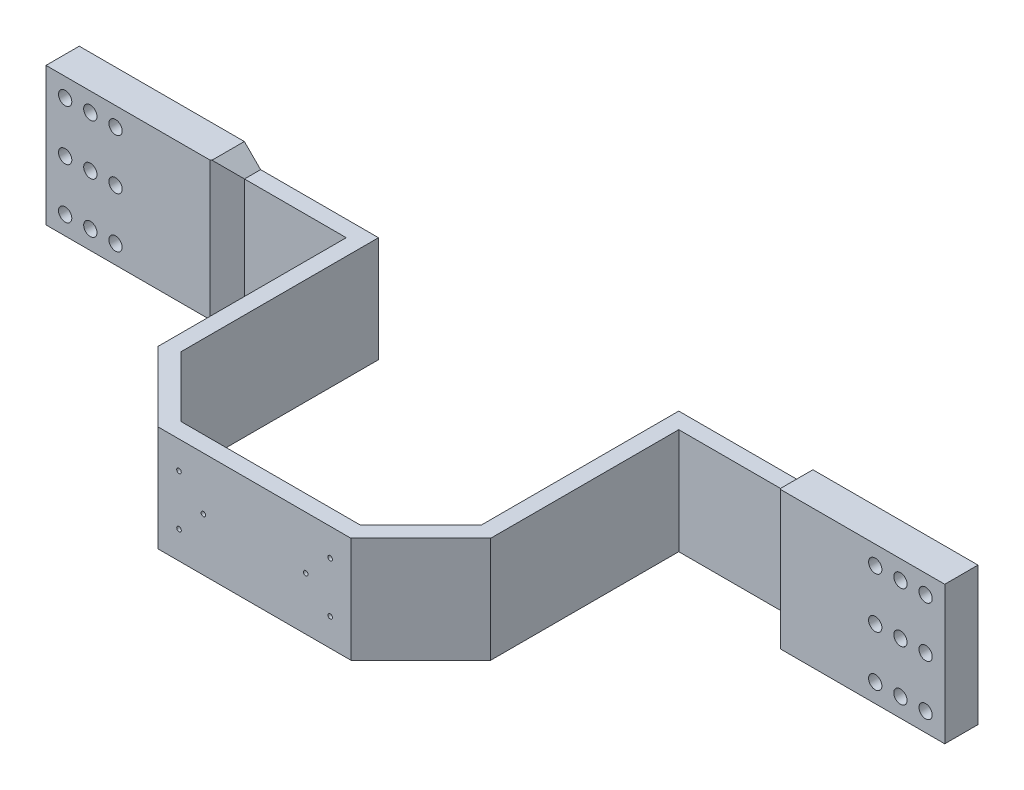
from build123d import *

# Parameters (mm, degrees)
BOSS_EXTRUDE1_DEPTH            = 52.45
F_4_40_TAPPED_HOLE1_D          = 2.2606
SKETCH14_W                     = 80
SKETCH14_H                     = 8.065
BOSS_EXTRUDE2_DEPTH            = 8
SKETCH19_W                     = 80
SKETCH19_H                     = 68.58
BOSS_EXTRUDE3_DEPTH            = 8.5
CBORE_FOR_M6_SHCS2_D           = 6.6
CBORE_FOR_M6_SHCS2_CBORE_D     = 11
CBORE_FOR_M6_SHCS2_CBORE_DEPTH = 6
CHAMFER1_SIZE                  = 10
CHAMFER2_SIZE                  = 10
CHAMFER3_SIZE                  = 10


with BuildPart() as part:
    # Sketch1 → Boss-Extrude1 (new body)
    with BuildSketch(Plane(origin=(0, 0, 0), x_dir=(1, 0, 0), z_dir=(0, 1, 0))):
        Polygon((74.5, 8), (74.5, -90), (44.5, -120), (-44.5, -120), (-74.5, -90), (-74.5, 8), (-223, 8), (-223, 0), (-82.5, 0), (-82.5, -93.313708499), (-47.813708499, -128), (47.813708499, -128), (82.5, -93.313708499), (82.5, 0), (223, 0), (223, 8), align=None)
    extrude(amount=BOSS_EXTRUDE1_DEPTH)

    # #4-40 Tapped Hole1 (through all)
    with Locations(Plane(origin=(0, 0, 120), x_dir=(-1, 0, 0), z_dir=(0, 0, -1))):
        with Locations((-37.5, 38.725), (-37.5, 13.725), (37.5, 13.725), (37.5, 38.725), (-25.4, 26.225), (25.4, 26.225)):
            Hole(F_4_40_TAPPED_HOLE1_D / 2)

    # Sketch14 → Boss-Extrude2 (add)
    with BuildSketch(Plane(origin=(0, 0, -8), x_dir=(-1, 0, 0), z_dir=(0, 0, -1))):
        with Locations((-183, 56.4825)):
            Rectangle(SKETCH14_W, SKETCH14_H)
        with Locations((-183, -4.0325)):
            Rectangle(SKETCH14_W, SKETCH14_H)
        with Locations((183, -4.0325)):
            Rectangle(SKETCH14_W, SKETCH14_H)
        with Locations((183, 56.4825)):
            Rectangle(SKETCH14_W, SKETCH14_H)
    extrude(amount=-BOSS_EXTRUDE2_DEPTH)

    # Sketch19 → Boss-Extrude3 (add)
    with BuildSketch(Plane.XY):
        with Locations((-183, 26.225)):
            Rectangle(SKETCH19_W, SKETCH19_H)
        with Locations((183, 26.225)):
            Rectangle(SKETCH19_W, SKETCH19_H)
    extrude(amount=BOSS_EXTRUDE3_DEPTH)

    # CBORE for M6 SHCS2 (through all)
    with Locations(Plane(origin=(0, 0, -8), x_dir=(-1, 0, 0), z_dir=(0, 0, -1))):
        with Locations((-201, 1.225), (-201, 26.225), (-201, 51.225), (201, 1.225), (201, 26.225), (201, 51.225), (-188.5, 51.225), (-213.5, 51.225), (-213.5, 1.225), (-213.5, 26.225), (-188.5, 26.225), (-188.5, 1.225), (188.5, 1.225), (188.5, 26.225), (188.5, 51.225), (213.5, 51.225), (213.5, 1.225), (213.5, 26.225)):
            CounterBoreHole(CBORE_FOR_M6_SHCS2_D / 2, CBORE_FOR_M6_SHCS2_CBORE_D / 2, CBORE_FOR_M6_SHCS2_CBORE_DEPTH)

    # Chamfer1
    # the kernel refuses this chamfer: 10 mm, written as the material it adds along each edge
    with BuildSketch(Plane(origin=(143, 52.45, -8), x_dir=(-0.9996219169112968, -0.027495876610586282, 0), z_dir=(0, 0, 1))) as chamfer1_piece_1_section:
        Polygon((CHAMFER1_SIZE * 0.999621916911, -CHAMFER1_SIZE * 0.0274958766106), (-CHAMFER1_SIZE * 0.0274958766106, -CHAMFER1_SIZE * 0.999621916911), (0, 0), align=None)
    chamfer1_piece_1 = extrude(amount=8, mode=Mode.PRIVATE)
    chamfer1_piece_1 = split(chamfer1_piece_1, bisect_by=Plane(origin=(139.550321437, 60.515, -4), z_dir=(0, -1, 0)), keep=Keep.TOP, mode=Mode.PRIVATE)
    add(chamfer1_piece_1)
    with BuildSketch(Plane(origin=(143, 0, -8), x_dir=(-0.9996219169112969, 0.027495876610581386, 0), z_dir=(0, 0, 1))) as chamfer1_piece_2_section:
        Polygon((CHAMFER1_SIZE * 0.999621916911, CHAMFER1_SIZE * 0.0274958766106), (-CHAMFER1_SIZE * 0.0274958766106, CHAMFER1_SIZE * 0.999621916911), (0, 0), align=None)
    chamfer1_piece_2 = extrude(amount=8, mode=Mode.PRIVATE)
    chamfer1_piece_2 = split(chamfer1_piece_2, bisect_by=Plane(origin=(139.550321437, -8.065, -4), z_dir=(0, 1, 0)), keep=Keep.TOP, mode=Mode.PRIVATE)
    add(chamfer1_piece_2)
    with BuildSketch(Plane(origin=(-143, 0, -8), x_dir=(0.9996219169112969, 0.027495876610581386, 0), z_dir=(0, 0, 1))) as chamfer1_piece_3_section:
        Polygon((CHAMFER1_SIZE * 0.999621916911, -CHAMFER1_SIZE * 0.0274958766106), (-CHAMFER1_SIZE * 0.0274958766106, -CHAMFER1_SIZE * 0.999621916911), (0, 0), align=None)
    chamfer1_piece_3 = extrude(amount=8, mode=Mode.PRIVATE)
    chamfer1_piece_3 = split(chamfer1_piece_3, bisect_by=Plane(origin=(-139.550321437, -8.065, -4), z_dir=(0, 1, 0)), keep=Keep.TOP, mode=Mode.PRIVATE)
    add(chamfer1_piece_3)
    with BuildSketch(Plane(origin=(-143, 52.45, -8), x_dir=(0.9996219169112968, -0.027495876610586282, 0), z_dir=(0, 0, 1))) as chamfer1_piece_4_section:
        Polygon((CHAMFER1_SIZE * 0.999621916911, CHAMFER1_SIZE * 0.0274958766106), (-CHAMFER1_SIZE * 0.0274958766106, CHAMFER1_SIZE * 0.999621916911), (0, 0), align=None)
    chamfer1_piece_4 = extrude(amount=8, mode=Mode.PRIVATE)
    chamfer1_piece_4 = split(chamfer1_piece_4, bisect_by=Plane(origin=(-139.550321437, 60.515, -4), z_dir=(0, -1, 0)), keep=Keep.TOP, mode=Mode.PRIVATE)
    add(chamfer1_piece_4)

    # Chamfer2
    # the kernel refuses this chamfer: 10 mm, written as the material it adds along each edge
    with BuildSketch(Plane(origin=(143, -8.065, 0), x_dir=(0.027495876610908077, 0, 0.9996219169112879), z_dir=(0, 1, 0))) as chamfer2_piece_1_section:
        Polygon((CHAMFER2_SIZE * 0.999621916911, -CHAMFER2_SIZE * 0.0274958766106), (-CHAMFER2_SIZE * 0.0274958766109, -CHAMFER2_SIZE * 0.999621916911), (0, 0), align=None)
    chamfer2_piece_1 = extrude(amount=68.58, mode=Mode.PRIVATE)
    chamfer2_piece_1 = split(chamfer2_piece_1, bisect_by=Plane(origin=(140.422114736, -3.467675987, 8.5), z_dir=(0, 0, -1)), keep=Keep.TOP, mode=Mode.PRIVATE)
    chamfer2_piece_1 = split(chamfer2_piece_1, bisect_by=Plane(origin=(138.444895362, -5.444895362, 3.487912503), z_dir=(0.7071067811868302, 0.7071067811862648, 0)), keep=Keep.TOP, mode=Mode.PRIVATE)
    chamfer2_piece_1 = split(chamfer2_piece_1, bisect_by=Plane(origin=(140.422114736, 0, 3.487912503), z_dir=(0, -1, 0)), keep=Keep.TOP, mode=Mode.PRIVATE)
    add(chamfer2_piece_1)
    with BuildSketch(Plane(origin=(143, -8.065, 0), x_dir=(0.027495876610908077, 0, 0.9996219169112879), z_dir=(0, 1, 0))) as chamfer2_piece_2_section:
        Polygon((CHAMFER2_SIZE * 0.999621916911, -CHAMFER2_SIZE * 0.0274958766106), (-CHAMFER2_SIZE * 0.0274958766109, -CHAMFER2_SIZE * 0.999621916911), (0, 0), align=None)
    chamfer2_piece_2 = extrude(amount=68.58, mode=Mode.PRIVATE)
    chamfer2_piece_2 = split(chamfer2_piece_2, bisect_by=Plane(origin=(139.596737512, 52.45, 3.097187729), z_dir=(0, -1, 0)), keep=Keep.TOP, mode=Mode.PRIVATE)
    chamfer2_piece_2 = split(chamfer2_piece_2, bisect_by=Plane(origin=(139.596737512, 26.225, 8.5), z_dir=(0, 0, -1)), keep=Keep.TOP, mode=Mode.PRIVATE)
    chamfer2_piece_2 = split(chamfer2_piece_2, bisect_by=Plane(origin=(139.596737512, 0, 3.097187729), z_dir=(0, 1, 0)), keep=Keep.TOP, mode=Mode.PRIVATE)
    add(chamfer2_piece_2)
    with BuildSketch(Plane(origin=(143, -8.065, 0), x_dir=(0.027495876610908077, 0, 0.9996219169112879), z_dir=(0, 1, 0))) as chamfer2_piece_3_section:
        Polygon((CHAMFER2_SIZE * 0.999621916911, -CHAMFER2_SIZE * 0.0274958766106), (-CHAMFER2_SIZE * 0.0274958766109, -CHAMFER2_SIZE * 0.999621916911), (0, 0), align=None)
    chamfer2_piece_3 = extrude(amount=68.58, mode=Mode.PRIVATE)
    chamfer2_piece_3 = split(chamfer2_piece_3, bisect_by=Plane(origin=(140.422114736, 52.45, 3.487912503), z_dir=(0, 1, 0)), keep=Keep.TOP, mode=Mode.PRIVATE)
    chamfer2_piece_3 = split(chamfer2_piece_3, bisect_by=Plane(origin=(140.422114736, 55.917675987, 8.5), z_dir=(0, 0, -1)), keep=Keep.TOP, mode=Mode.PRIVATE)
    chamfer2_piece_3 = split(chamfer2_piece_3, bisect_by=Plane(origin=(138.444895362, 57.894895362, 3.487912503), z_dir=(0.7071067811868302, -0.7071067811862648, 0)), keep=Keep.TOP, mode=Mode.PRIVATE)
    add(chamfer2_piece_3)

    # Chamfer3
    # the kernel refuses this chamfer: 10 mm, written as the material it adds along each edge
    with BuildSketch(Plane(origin=(-143, 60.515, 0), x_dir=(-0.027495876610908083, 0, 0.9996219169112879), z_dir=(0, -1, 0))) as chamfer3_piece_1_section:
        Polygon((CHAMFER3_SIZE * 0.999621916911, -CHAMFER3_SIZE * 0.0274958766106), (-CHAMFER3_SIZE * 0.0274958766109, -CHAMFER3_SIZE * 0.999621916911), (0, 0), align=None)
    chamfer3_piece_1 = extrude(amount=68.58, mode=Mode.PRIVATE)
    chamfer3_piece_1 = split(chamfer3_piece_1, bisect_by=Plane(origin=(-140.422114736, 55.917675987, 8.5), z_dir=(0, 0, -1)), keep=Keep.TOP, mode=Mode.PRIVATE)
    chamfer3_piece_1 = split(chamfer3_piece_1, bisect_by=Plane(origin=(-138.444895362, 57.894895362, 3.487912503), z_dir=(-0.7071067811868302, -0.7071067811862648, 0)), keep=Keep.TOP, mode=Mode.PRIVATE)
    chamfer3_piece_1 = split(chamfer3_piece_1, bisect_by=Plane(origin=(-140.422114736, 52.45, 3.487912503), z_dir=(0, 1, 0)), keep=Keep.TOP, mode=Mode.PRIVATE)
    add(chamfer3_piece_1)
    with BuildSketch(Plane(origin=(-143, 60.515, 0), x_dir=(-0.027495876610908083, 0, 0.9996219169112879), z_dir=(0, -1, 0))) as chamfer3_piece_2_section:
        Polygon((CHAMFER3_SIZE * 0.999621916911, -CHAMFER3_SIZE * 0.0274958766106), (-CHAMFER3_SIZE * 0.0274958766109, -CHAMFER3_SIZE * 0.999621916911), (0, 0), align=None)
    chamfer3_piece_2 = extrude(amount=68.58, mode=Mode.PRIVATE)
    chamfer3_piece_2 = split(chamfer3_piece_2, bisect_by=Plane(origin=(-139.596737512, 0, 3.097187729), z_dir=(0, 1, 0)), keep=Keep.TOP, mode=Mode.PRIVATE)
    chamfer3_piece_2 = split(chamfer3_piece_2, bisect_by=Plane(origin=(-139.596737512, 26.225, 8.5), z_dir=(0, 0, -1)), keep=Keep.TOP, mode=Mode.PRIVATE)
    chamfer3_piece_2 = split(chamfer3_piece_2, bisect_by=Plane(origin=(-139.596737512, 52.45, 3.097187729), z_dir=(0, -1, 0)), keep=Keep.TOP, mode=Mode.PRIVATE)
    add(chamfer3_piece_2)
    with BuildSketch(Plane(origin=(-143, 60.515, 0), x_dir=(-0.027495876610908083, 0, 0.9996219169112879), z_dir=(0, -1, 0))) as chamfer3_piece_3_section:
        Polygon((CHAMFER3_SIZE * 0.999621916911, -CHAMFER3_SIZE * 0.0274958766106), (-CHAMFER3_SIZE * 0.0274958766109, -CHAMFER3_SIZE * 0.999621916911), (0, 0), align=None)
    chamfer3_piece_3 = extrude(amount=68.58, mode=Mode.PRIVATE)
    chamfer3_piece_3 = split(chamfer3_piece_3, bisect_by=Plane(origin=(-140.422114736, 0, 3.487912503), z_dir=(0, -1, 0)), keep=Keep.TOP, mode=Mode.PRIVATE)
    chamfer3_piece_3 = split(chamfer3_piece_3, bisect_by=Plane(origin=(-140.422114736, -3.467675987, 8.5), z_dir=(0, 0, -1)), keep=Keep.TOP, mode=Mode.PRIVATE)
    chamfer3_piece_3 = split(chamfer3_piece_3, bisect_by=Plane(origin=(-138.444895362, -5.444895362, 3.487912503), z_dir=(-0.7071067811868302, 0.7071067811862648, 0)), keep=Keep.TOP, mode=Mode.PRIVATE)
    add(chamfer3_piece_3)


solid = part.part
